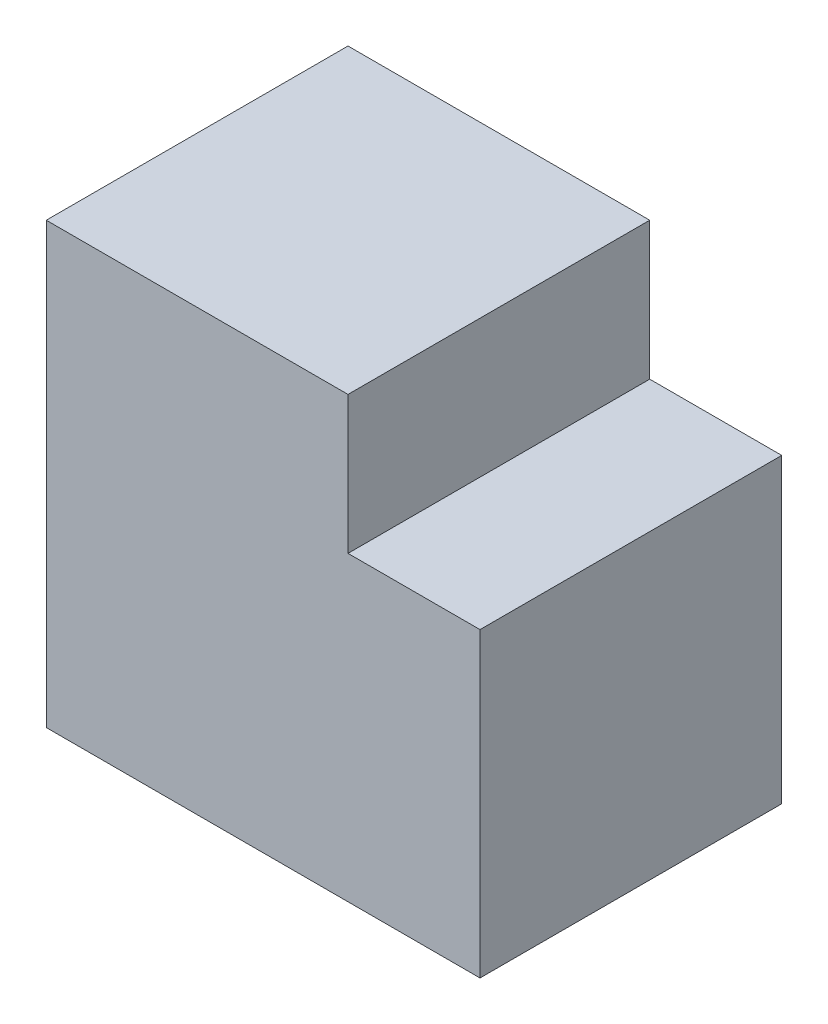
from build123d import *

# Parameters (mm, degrees)
SKETCH1_W           = 40.64
SKETCH1_H           = 40.64
BOSS_EXTRUDE1_DEPTH = 59.182
SKETCH2_W           = 40.64
SKETCH2_H           = 40.64
BOSS_EXTRUDE2_DEPTH = 17.78
SHELL1_START        = -36.762774376
SHELL1_OUTLINE_W    = 54.102
SHELL1_OUTLINE_H    = 35.56
SHELL1_DEPTH        = 35.56
SHELL1_START_2      = -1.202774376
SHELL1_2_OUTLINE_W  = 35.56
SHELL1_2_OUTLINE_H  = 35.56
SHELL1_2_DEPTH      = 17.78


# Read off the part's stored shape, not the designer's step: Shell1
with BuildPart() as part:
    # Sketch1 → Boss-Extrude1 (new body)
    with BuildSketch(Plane(origin=(0, 0, 0), x_dir=(1, 0, 0), z_dir=(0, 1, 0))):
        with Locations((-18.982774376, 6.236831683)):
            Rectangle(SKETCH1_W, SKETCH1_H)
    extrude(amount=BOSS_EXTRUDE1_DEPTH)

    # Sketch2 → Boss-Extrude2 (add)
    with BuildSketch(Plane(origin=(1.337225624, 0, 0), x_dir=(0, 0, -1), z_dir=(1, 0, 0))):
        with Locations((6.236831683, 20.32)):
            Rectangle(SKETCH2_W, SKETCH2_H)
    extrude(amount=BOSS_EXTRUDE2_DEPTH)

    # Shell1 outline → Shell1 (cut)
    with BuildSketch(Plane.YZ.offset(SHELL1_START)):
        with Locations((29.591, -6.236831683)):
            Rectangle(SHELL1_OUTLINE_W, SHELL1_OUTLINE_H)
    extrude(amount=SHELL1_DEPTH, mode=Mode.SUBTRACT)

    # Shell1 2 outline → Shell1 2 (cut)
    with BuildSketch(Plane.YZ.offset(SHELL1_START_2)):
        with Locations((20.32, -6.236831683)):
            Rectangle(SHELL1_2_OUTLINE_W, SHELL1_2_OUTLINE_H)
    extrude(amount=SHELL1_2_DEPTH, mode=Mode.SUBTRACT)


solid = part.part
